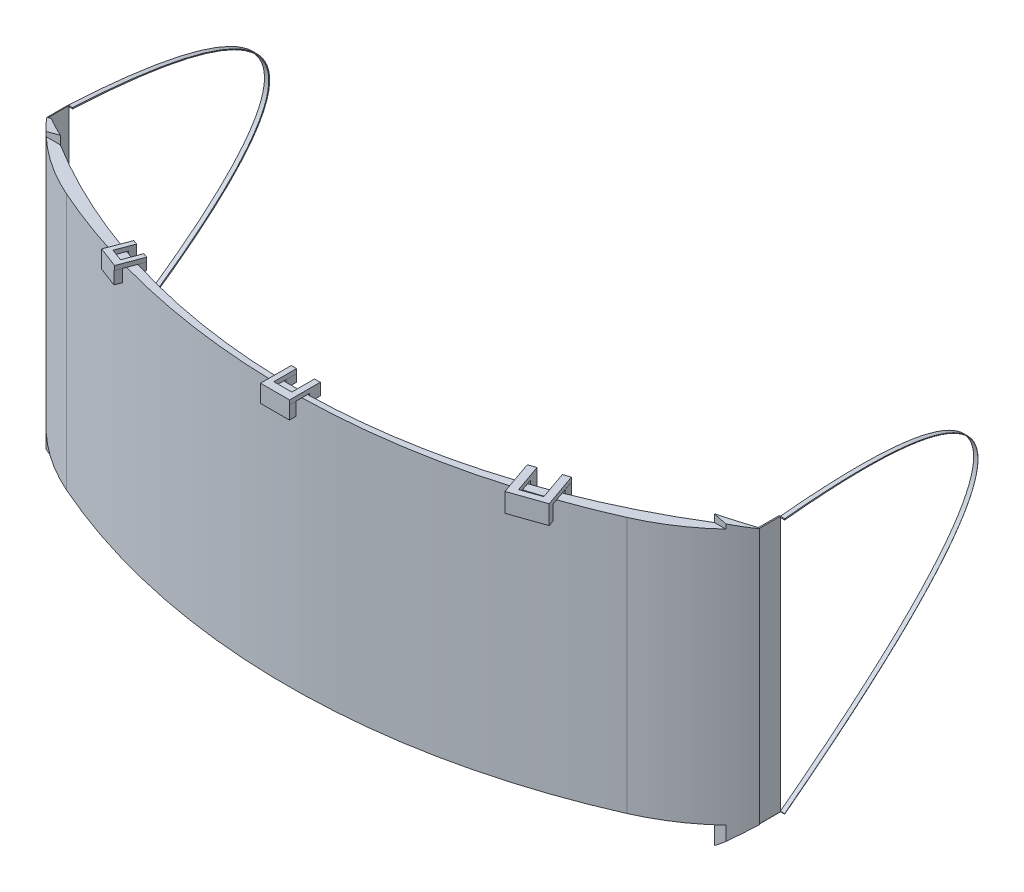
from build123d import *

# Parameters (mm, degrees)
SALIENTE_EXTRUIR1_DEPTH    = 4
SALIENTE_EXTRUIR2_DEPTH    = 60
CROQUIS3_W                 = 0.289029692
CROQUIS3_H                 = 59.87540196
CROQUIS3_W_2               = 0.177592091
CROQUIS3_H_2               = 59.973158088
SALIENTE_EXTRUIR3_DEPTH    = 5
SALIENTE_EXTRUIR4_DEPTH    = 5
REDONDEO1_R                = 50
REDONDEO2_R                = 50
SALIENTE_EXTRUIR5_DEPTH    = 1
SALIENTE_EXTRUIR6_DEPTH    = 1
CORTAR_EXTRUIR6_DEPTH      = 100
CORTAR_EXTRUIR6_DEPTH_BACK = 100
SALIENTE_EXTRUIR8_DEPTH    = 1
CROQUIS14_W                = 1.546959861
CROQUIS14_H                = 3.108298136
SALIENTE_EXTRUIR9_DEPTH    = 4.95
CROQUIS17_W                = 1.106278156
CROQUIS17_H                = 1.527135833
SALIENTE_EXTRUIR10_DEPTH   = 1.5
SALIENTE_EXTRUIR11_DEPTH   = 1.5
SALIENTE_EXTRUIR20_DEPTH   = 1
SALIENTE_EXTRUIR21_DEPTH   = 2.5
SALIENTE_EXTRUIR22_DEPTH   = 2.5
SALIENTE_EXTRUIR23_DEPTH   = 1.5
SALIENTE_EXTRUIR24_DEPTH   = 1
CROQUIS25_W                = 8.124604313
CROQUIS25_H                = 3.439267379
SALIENTE_EXTRUIR26_DEPTH   = 1.5
CROQUIS26_W                = 1.653966606
CROQUIS26_H                = 2.676005595
SALIENTE_EXTRUIR27_DEPTH   = 2.5
SALIENTE_EXTRUIR28_DEPTH   = 2.5


with BuildPart() as part:
    # Croquis1 → Saliente-Extruir1 (new body)
    with BuildSketch(Plane.XY):
        with BuildLine():
            Line((0, 0), (83.333477934, 22.852667115))
            Line((83.333477934, 22.852667115), (166.666955868, 0))
            Line((166.666955868, 0), (166.666955868, -60))
            ThreePointArc((166.666955868, -60), (83.333477934, -92.017871072), (0, -60))
            Line((0, -60), (0, 0))
        make_face()
    extrude(amount=SALIENTE_EXTRUIR1_DEPTH)

    # Croquis2 → Saliente-Extruir2 (add)
    with BuildSketch(Plane(origin=(0, 0, 0), x_dir=(1, 0, 0), z_dir=(0, 1, 0))):
        with BuildLine():
            Line((0, -4), (166.666955868, -4))
            ThreePointArc((166.666955868, -4), (83.333477934, -27.024341585), (0, -4))
        make_face()
    extrude(amount=-SALIENTE_EXTRUIR2_DEPTH)

    # Croquis3 → Saliente-Extruir3 (add)
    with BuildSketch(Plane(origin=(0, 0, 0), x_dir=(-1, 0, 0), z_dir=(0, 0, -1))):
        with Locations((-166.467895628, -29.93770098)):
            Rectangle(CROQUIS3_W, CROQUIS3_H)
        with Locations((-0.088843275, -29.986579044)):
            Rectangle(CROQUIS3_W_2, CROQUIS3_H_2)
    extrude(amount=SALIENTE_EXTRUIR3_DEPTH)

    # Croquis4 → Saliente-Extruir4 (add)
    with BuildSketch(Plane(origin=(0, 0, 0), x_dir=(-1, 0, 0), z_dir=(0, 0, -1))):
        with BuildLine():
            Line((-166.575051433, -59.952097452), (-166.327771804, -59.952097452))
            ThreePointArc((-166.327771804, -59.952097452), (-83.259391035, -91.42682448), (-0.171692336, -60.003128804))
            Line((-0.171692336, -60.003128804), (-0.054856283, -60.003128804))
            ThreePointArc((-0.054856283, -60.003128804), (-83.324689996, -91.747566021), (-166.575051433, -59.952097452))
        make_face()
    extrude(amount=SALIENTE_EXTRUIR4_DEPTH)

    # Redondeo1
    # the kernel refuses this fillet: 50 mm, written as the material it takes off along each edge
    with BuildSketch(Plane(origin=(166.666955868, 49.966304068, 4), x_dir=(0, 0, -1), z_dir=(0, -1, 0))) as redondeo1_piece_1:
        with BuildLine():
            CenterArc((36.551638367, -37.952481337), REDONDEO1_R, 130.619513434, 25.549773404)
            Line((-9.185522516, -17.750696405), (-10.100265733, -17.346660707))
            ThreePointArc((-10.100265733, -17.346660707), (-5.754361432, -8.274250403), (-0.858153989, 0.513392375))
            Line((-0.858153989, 0.513392375), (0, 1))
            ThreePointArc((0, 1), (2, 1), (3.348967233, 0.759049627))
            Line((3.348967233, 0.759049627), (4, 0))
        make_face()
    extrude(amount=159.932608137, mode=Mode.SUBTRACT)

    # Redondeo2
    # the kernel refuses this fillet: 50 mm, written as the material it takes off along each edge
    with BuildSketch(Plane(origin=(0, -109.966304068, 4), x_dir=(0, 0, -1), z_dir=(0, 1, 0))) as redondeo2_piece_1:
        with BuildLine():
            CenterArc((36.551638367, -37.952481337), REDONDEO2_R, 130.619513434, 25.549773404)
            Line((-9.185522516, -17.750696405), (-10.100265733, -17.346660707))
            ThreePointArc((-10.100265733, -17.346660707), (-5.754361432, -8.274250403), (-0.858153989, 0.513392375))
            Line((-0.858153989, 0.513392375), (0, 1))
            ThreePointArc((0, 1), (2, 1), (3.348967233, 0.759049627))
            Line((3.348967233, 0.759049627), (4, 0))
        make_face()
    extrude(amount=159.932608137, mode=Mode.SUBTRACT)

    # Croquis6 → Saliente-Extruir5 (add)
    with BuildSketch(Plane(origin=(0, 0, 0), x_dir=(0, 0, -1), z_dir=(1, 0, 0))):
        with BuildLine():
            Line((5, 0), (5, -0.29960532))
            add(Edge.make_bspline(
                [(5, -0.29960532), (96.808979423, -4.943573918), (5, -59.582645774)],
                knots=[0, 0, 0, 1, 1, 1], degree=2))
            Line((5, -59.582645774), (5, -59.952097452))
            add(Edge.make_bspline(
                [(5, 0), (97.240633966, -5.026465085), (5, -59.952097452)],
                knots=[0, 0, 0, 1, 1, 1], degree=2))
        make_face()
    extrude(amount=SALIENTE_EXTRUIR5_DEPTH)

    # Croquis9 → Cortar-Extruir6 (cut, two sides: drawn at the far end of the back side and taken through both)
    with BuildSketch(Plane(origin=(0, 0, 0), x_dir=(1, 0, 0), z_dir=(0, 1, 0)).offset(-CORTAR_EXTRUIR6_DEPTH_BACK)):
        with BuildLine():
            Line((1, 5), (166.327771804, 5))
            Line((166.327771804, 5), (166.327771804, 0))
            ThreePointArc((166.327771804, 0), (83.663885902, -25.706781267), (1, 0))
            Line((1, 0), (1, 5))
        make_face()
    extrude(amount=CORTAR_EXTRUIR6_DEPTH + CORTAR_EXTRUIR6_DEPTH_BACK, mode=Mode.SUBTRACT)

    # Croquis11 → Saliente-Extruir8 (add)
    with BuildSketch(Plane(origin=(0, 0, 0), x_dir=(1, 0, 0), z_dir=(0, 1, 0))):
        Polygon((36.128583572, -15.796167366), (34.062264647, -21.243735439), (38.935063324, -23.092038385), (41.001382248, -17.644470312), (39.968222786, -17.25258224), (38.45433709, -21.243735439), (35.649065215, -20.179666797), (37.162950911, -16.188513598), align=None)
    extrude(amount=SALIENTE_EXTRUIR8_DEPTH)

    # Croquis14 → Saliente-Extruir9 (add)
    with BuildSketch(Plane(origin=(36.822366085, 0, 13.967104377), x_dir=(-0.3546542341205386, 0, 0.9349975263177835), z_dir=(-0.9349975263177834, 0, -0.35465423412053854))):
        with Locations((7.009033774, -1.554149068)):
            Rectangle(CROQUIS14_W, CROQUIS14_H)
    extrude(amount=-SALIENTE_EXTRUIR9_DEPTH)

    # Croquis17 → Saliente-Extruir10 (add)
    with BuildSketch(Plane(origin=(-0.693782513, 0, 1.829062989), x_dir=(-0.9349975263177834, 0, -0.3546542341205389), z_dir=(0.35465423412053887, 0, -0.9349975263177833))):
        with Locations((-39.935452986, -0.763567916)):
            Rectangle(CROQUIS17_W, CROQUIS17_H)
    extrude(amount=-SALIENTE_EXTRUIR10_DEPTH)

    # Croquis19 → Saliente-Extruir20 (add)
    with BuildSketch(Plane(origin=(0, 0, 0), x_dir=(1, 0, 0), z_dir=(0, 1, 0))):
        Polygon((81.107233495, -28.004030405), (81.107233495, -22.686499047), (79.854642746, -22.686499047), (79.854642746, -29.86379276), (86.643974636, -29.86379276), (86.643974636, -22.686499047), (85.30129239, -22.686499047), (85.30129239, -28.004030405), align=None)
    extrude(amount=SALIENTE_EXTRUIR20_DEPTH)

    # Croquis20 → Saliente-Extruir21 (add)
    with BuildSketch(Plane(origin=(0, 0, 22.686499047), x_dir=(-1, 0, 0), z_dir=(0, 0, -1))):
        Polygon((-86.643974636, 0), (-86.643974636, -1.776510708), (-85.314516973, -1.776510708), (-85.30129239, 0), align=None)
    extrude(amount=-SALIENTE_EXTRUIR21_DEPTH)

    # Croquis22 → Saliente-Extruir22 (add)
    with BuildSketch(Plane(origin=(0, 0, 22.686499047), x_dir=(-1, 0, 0), z_dir=(0, 0, -1))):
        Polygon((-79.854642746, 0), (-79.854642746, -1.799894924), (-81.071701167, -1.799894924), (-81.107233495, 0), align=None)
    extrude(amount=-SALIENTE_EXTRUIR22_DEPTH)

    # Croquis23 → Saliente-Extruir23 (add)
    with BuildSketch(Plane.XY.offset(29.86379276)):
        Polygon((79.854642746, 0), (79.854642746, -3.091551628), (86.604630452, -3.091551628), (86.643974636, 0), align=None)
    extrude(amount=-SALIENTE_EXTRUIR23_DEPTH)

    # Croquis24 → Saliente-Extruir24 (add)
    with BuildSketch(Plane(origin=(0, 0, 0), x_dir=(1, 0, 0), z_dir=(0, 1, 0))):
        Polygon((127.577085334, -15.195398317), (130.368867149, -23.198506187), (138.040120015, -20.522487745), (135.2483382, -12.519379875), (133.660709286, -13.073203915), (135.978252363, -19.716827403), (131.59226066, -21.246824508), (129.274717583, -14.603201021), align=None)
    extrude(amount=SALIENTE_EXTRUIR24_DEPTH)

    # Croquis25 → Saliente-Extruir26 (add)
    with BuildSketch(Plane(origin=(21.357778013, 0, 61.225630304), x_dir=(0.9442001814457763, 0, -0.3293721563182948), z_dir=(0.32937215631829475, 0, 0.9442001814457762))):
        with Locations((119.515668168, -1.71963369)):
            Rectangle(CROQUIS25_W, CROQUIS25_H)
    extrude(amount=-SALIENTE_EXTRUIR26_DEPTH)

    # Croquis26 → Saliente-Extruir27 (add)
    with BuildSketch(Plane(origin=(18.565996198, 0, 53.222522434), x_dir=(-0.9442001814457758, 0, 0.3293721563182962), z_dir=(-0.3293721563182962, 0, -0.9442001814457758))):
        with Locations((-122.761908505, -1.338002798)):
            Rectangle(CROQUIS26_W, CROQUIS26_H)
    extrude(amount=-SALIENTE_EXTRUIR27_DEPTH)

    # Croquis27 → Saliente-Extruir28 (add)
    with BuildSketch(Plane(origin=(18.565996198, 0, 53.222522434), x_dir=(-0.9442001814457753, 0, 0.3293721563182975), z_dir=(-0.3293721563182975, 0, -0.9442001814457753))):
        Polygon((-117.251323989, 0), (-117.251323989, -2.641002762), (-115.464919434, -2.641002762), (-115.453366011, 0), align=None)
    extrude(amount=-SALIENTE_EXTRUIR28_DEPTH)


with BuildPart() as body_2:
    # Croquis8 → Saliente-Extruir6 (new body)
    with BuildSketch(Plane(origin=(166.612410474, 0, 0), x_dir=(0, 0, -1), z_dir=(1, 0, 0))):
        with BuildLine():
            Line((5, -0.29177164), (5, 0))
            add(Edge.make_bspline(
                [(5, 0), (95.452044638, 8.889076333), (5, -59.87540196)],
                knots=[0, 0, 0, 1, 1, 1], degree=2))
            Line((5, -59.87540196), (5, -59.752239474))
            add(Edge.make_bspline(
                [(5, -0.29177164), (95.404420621, 8.902780741), (5, -59.752239474)],
                knots=[0, 0, 0, 1, 1, 1], degree=2))
        make_face()
    extrude(amount=SALIENTE_EXTRUIR6_DEPTH)


with BuildPart() as body_3:
    # Croquis18 → Saliente-Extruir11 (new body)
    with BuildSketch(Plane(origin=(-0.693782513, 0, 1.829062989), x_dir=(-0.9349975263177843, 0, -0.35465423412053654), z_dir=(0.3546542341205365, 0, -0.9349975263177842))):
        Polygon((-43.488385393, -0.018465758), (-43.488385393, -1.747366455), (-44.545407148, -1.747366455), (-44.545407148, 0), align=None)
    extrude(amount=-SALIENTE_EXTRUIR11_DEPTH)


solid = Compound([part.part, body_2.part, body_3.part])
